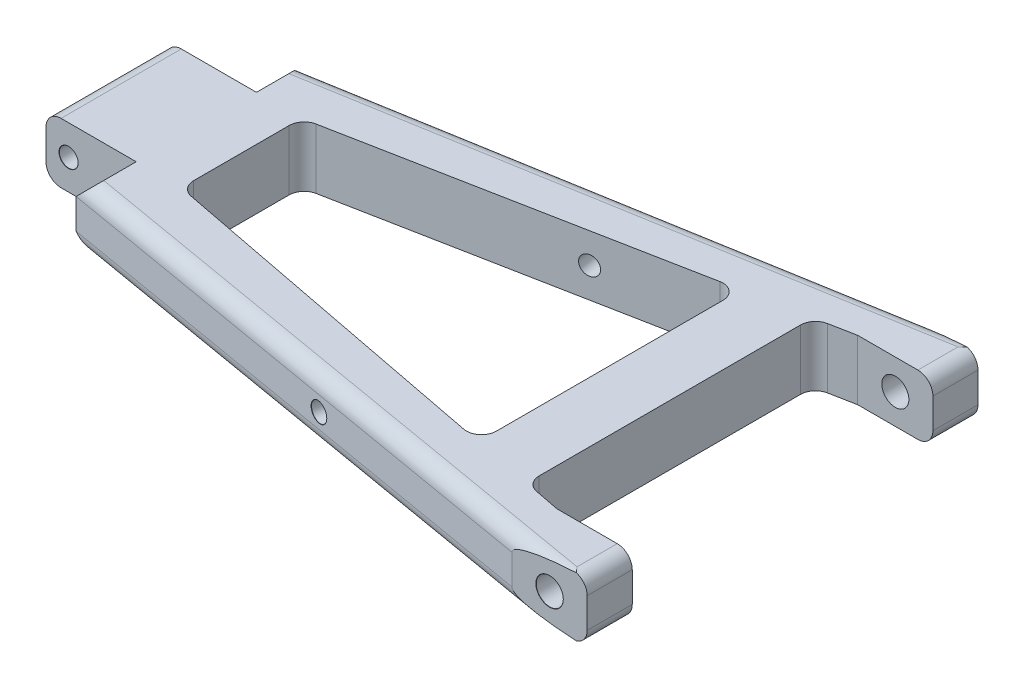
from build123d import *

# Parameters (mm, degrees)
BOSS_EXTRUDE1_DEPTH                   = 4
SKETCH3_R                             = 1
CUT_EXTRUDE2_DEPTH                    = 96.498691091
SKETCH4_R                             = 1
CUT_EXTRUDE3_DEPTH                    = 88.017239671
TAP_DRILL_FOR_M3X0_5_TAP2_D           = 2.5
TAP_DRILL_FOR_M3X0_5_TAP2_CSINK_D     = 2.55
TAP_DRILL_FOR_M3X0_5_TAP2_CSINK_ANGLE = 90
M3_CLEARANCE_HOLE2_D                  = 3.6
M3_CLEARANCE_HOLE2_CSINK_D            = 3.65
M3_CLEARANCE_HOLE2_CSINK_ANGLE        = 90
FILLET1_R                             = 2
CHAMFER1_SIZE                         = 2
FILLET2_R                             = 2


# Read off the part's stored shape, not the designer's step: Tap Drill for M3x0.5 Tap4, Tap Drill for M3x0.5 Tap5
with BuildPart() as part:
    # Sketch1 → Boss-Extrude1 (new, symmetric)
    with BuildSketch(Plane(origin=(0, 0, 0), x_dir=(1, 0, 0), z_dir=(0, 1, 0))):
        with BuildLine():
            Line((0, 8), (-10, 8))
            Line((-10, 8), (-10, -8))
            Line((-10, -8), (0, -8))
            Line((0, -8), (0, -14))
            Line((0, -14), (70, -26))
            Line((70, -26), (80, -26))
            Line((80, -26), (80, -20))
            Line((80, -20), (70, -20))
            Line((70, -20), (66.619956187, -19.345797972))
            ThreePointArc((66.619956187, -19.345797972), (65.457260938, -18.655013265), (65, -17.38223827))
            Line((65, -17.38223827), (65, 17.38223827))
            ThreePointArc((65, 17.38223827), (65.457260938, 18.655013265), (66.619956187, 19.345797972))
            Line((66.619956187, 19.345797972), (70, 20))
            Line((70, 20), (80, 20))
            Line((80, 20), (80, 26))
            Line((80, 26), (70, 26))
            Line((70, 26), (0, 14))
            Line((0, 14), (0, 8))
        make_face()
        with BuildLine():
            Line((8, 6.349980206), (8, -6.349980206))
            ThreePointArc((8, -6.349980206), (8.457260938, -7.622755201), (9.619956187, -8.313539907))
            Line((9.619956187, -8.313539907), (54.619956187, -17.023217326))
            ThreePointArc((54.619956187, -17.023217326), (56.272774995, -16.602396687), (57, -15.059657625))
            Line((57, -15.059657625), (57, 15.059657625))
            ThreePointArc((57, 15.059657625), (56.272774995, 16.602396687), (54.619956187, 17.023217326))
            Line((54.619956187, 17.023217326), (9.619956187, 8.313539907))
            ThreePointArc((9.619956187, 8.313539907), (8.457260938, 7.622755201), (8, 6.349980206))
        make_face(mode=Mode.SUBTRACT)
    extrude(amount=BOSS_EXTRUDE1_DEPTH, both=True)

    # Sketch3 → Cut-Extrude2 (cut, through all)
    with BuildSketch(Plane.XY.offset(26)):
        with Locations((75, 0)):
            Circle(SKETCH3_R)
    extrude(amount=-CUT_EXTRUDE2_DEPTH, mode=Mode.SUBTRACT)

    # Sketch4 → Cut-Extrude3 (cut, through all)
    with BuildSketch(Plane.XY.offset(8)):
        with Locations((-7, 0)):
            Circle(SKETCH4_R)
    extrude(amount=-CUT_EXTRUDE3_DEPTH, mode=Mode.SUBTRACT)

    # Tap Drill for M3x0.5 Tap2 (through all)
    with Locations(Plane.XY.offset(8)):
        with Locations((-7, 0)):
            CounterSinkHole(TAP_DRILL_FOR_M3X0_5_TAP2_D / 2, TAP_DRILL_FOR_M3X0_5_TAP2_CSINK_D / 2, counter_sink_angle=TAP_DRILL_FOR_M3X0_5_TAP2_CSINK_ANGLE)

    # M3 Clearance Hole2 (through all)
    with Locations(Plane.XY.offset(26)):
        with Locations((75, 0)):
            CounterSinkHole(M3_CLEARANCE_HOLE2_D / 2, M3_CLEARANCE_HOLE2_CSINK_D / 2, counter_sink_angle=M3_CLEARANCE_HOLE2_CSINK_ANGLE)

    # Fillet1
    fillet1_edges = [part.edges().sort_by_distance(p)[0] for p in [
        (-10, 4, 0),
        (80, -4, -23),
        (80, -4, 23),
        (-10, -4, 0),
        (80, 4, 23),
        (80, 4, -23),
    ]]
    fillet(fillet1_edges, radius=FILLET1_R)

    # Chamfer1
    chamfer1_edges = [part.edges().sort_by_distance(p)[0] for p in [
        (0, 4, 11),
        (0, -4, 11),
        (0, -4, -11),
        (0, 4, -11),
    ]]
    chamfer(chamfer1_edges, length=CHAMFER1_SIZE)

    # Tap Drill for M3x0.5 Tap4 outline → Tap Drill for M3x0.5 Tap4 (revolve, cut)
    with BuildSketch(Plane(origin=(41.33148295, 0, 7.085397077), x_dir=(0.9856222548132666, 0, 0.1689638151108459), z_dir=(0, 1, 0))):
        Polygon((1.25, -13.773711567), (1.25, -7.206179724), (0, -7.206179724), (0, -13.798711567), (1.275, -13.798711567), align=None)
    revolve(axis=Axis((41.33148295, 0, 7.085397077), (0.1689638151108459, 0, -0.9856222548132666)), mode=Mode.SUBTRACT)

    # Tap Drill for M3x0.5 Tap5 outline → Tap Drill for M3x0.5 Tap5 (revolve, cut)
    with BuildSketch(Plane(origin=(41.33148295, 0, -7.085397077), x_dir=(0.9856222548132666, 0, -0.1689638151108459), z_dir=(0, -1, 0))):
        Polygon((1.25, -13.773711567), (1.25, -7.206546017), (0, -7.206546017), (0, -13.798711567), (1.275, -13.798711567), align=None)
    revolve(axis=Axis((41.33148295, 0, -7.085397077), (0.1689638151108459, 0, 0.9856222548132666)), mode=Mode.SUBTRACT)

    # Fillet2
    # the kernel refuses this fillet: 2 mm, written as the material it takes off along each edge
    with BuildSketch(Plane(origin=(-9.827467058, -4, 12.315291362), x_dir=(0.1689638151108459, 0, -0.9856222548132667), z_dir=(0.9856222548132667, 0, 0.16896381511084588)), Plane(origin=(-9.827467058, 4, 12.315291362), x_dir=(0, -1, 0), z_dir=(0.9856222548132667, 0, 0.16896381511084588)), Plane(origin=(81.827467058, -4, -28.027565781), x_dir=(0.16896381511084588, 0, 0.9856222548132667), z_dir=(-0.9856222548132667, 0, 0.16896381511084588)), Plane(origin=(81.827467058, 4, -28.027565781), x_dir=(0, -1, 0), z_dir=(-0.9856222548132667, 0, 0.16896381511084588))) as fillet2_piece_1:
        with BuildLine():
            CenterArc((FILLET2_R, FILLET2_R), FILLET2_R, 180, 90)
            Line((0, FILLET2_R), (-FILLET2_R * 0.02, FILLET2_R))
            Line((-FILLET2_R * 0.02, FILLET2_R), (-FILLET2_R * 0.02, -FILLET2_R * 0.02))
            Line((-FILLET2_R * 0.02, -FILLET2_R * 0.02), (FILLET2_R, -FILLET2_R * 0.02))
            Line((FILLET2_R, -FILLET2_R * 0.02), (FILLET2_R, 0))
        make_face()
    extrude(amount=92.991948658, mode=Mode.SUBTRACT)


solid = part.part
